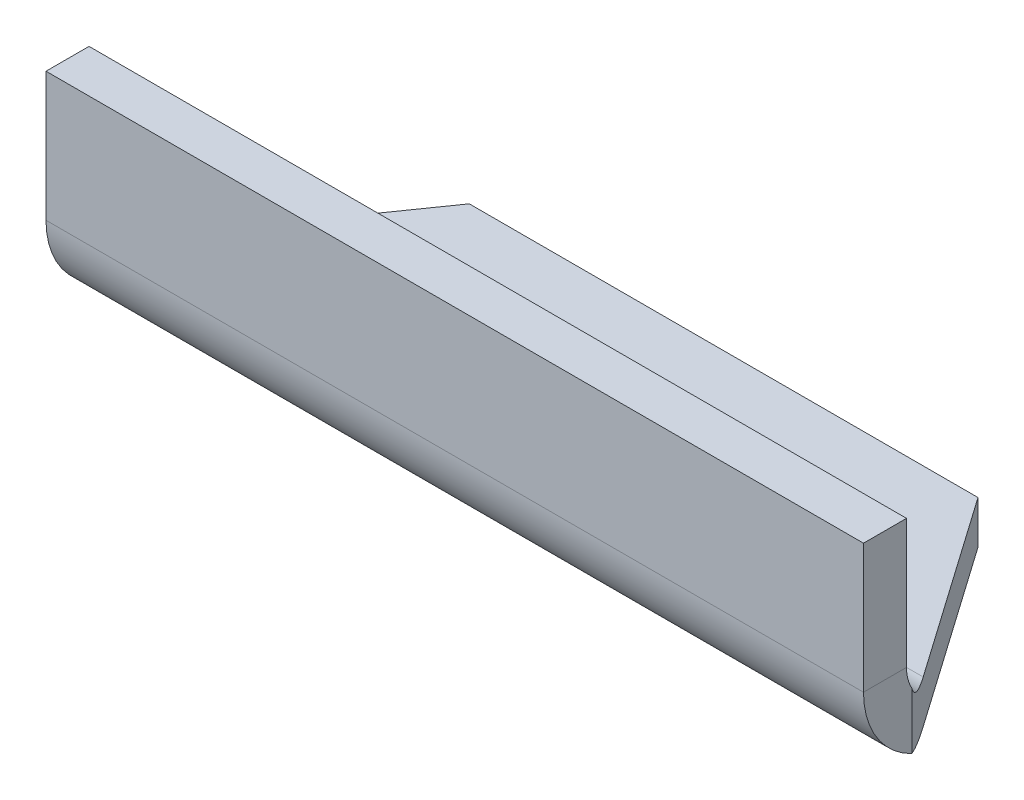
from build123d import *

# Parameters (mm, degrees)
SKETCH1_W                    = 152
SKETCH1_H                    = 50
BASE_FLANGE1_DEPTH           = 8
EDGE_FLANGE1_STRIP_W         = 48
EDGE_FLANGE1_STRIP_H         = 8
EDGE_FLANGE1_STRIP_CUT_DEPTH = 152
EDGE_FLANGE1_DEPTH           = 152
CHAMFER1_SIZE                = 41
CHAMFER1_SIZE2               = 28.708509067
MIRROR3_START                = 53.078332384
MIRROR3_OUTLINE_W            = 53
MIRROR3_OUTLINE_H            = 14
MIRROR3_DEPTH                = 23.516633891


# Read off the part's stored shape, not the designer's step: Mirror3
# Sheet-metal steps are written as plain solids
with BuildPart() as part:
    # Sketch1 → Base-Flange1 (new body)
    with BuildSketch(Plane(origin=(0, 0, 0), x_dir=(1, 0, 0), z_dir=(0, 1, 0))):
        Rectangle(SKETCH1_W, SKETCH1_H)
    extrude(amount=-BASE_FLANGE1_DEPTH)

    # Edge-Flange1 strip (across the edge) → Edge-Flange1 strip cut (cut)
    with BuildSketch(Plane(origin=(-76, 0, 25), x_dir=(0, 0, -1), z_dir=(1, 0, 0))):
        with Locations((-8, -4)):
            Rectangle(EDGE_FLANGE1_STRIP_W, EDGE_FLANGE1_STRIP_H)
    extrude(amount=EDGE_FLANGE1_STRIP_CUT_DEPTH, mode=Mode.SUBTRACT)

    # Edge-Flange1 section (across the edge) → Edge-Flange1 (add)
    with BuildSketch(Plane(origin=(-76, 0, 25), x_dir=(0, 0, -1), z_dir=(1, 0, 0))):
        with BuildLine():
            Line((0, 8), (0, 32))
            Line((0, 32), (8, 32))
            Line((8, 32), (8, 8))
            ThreePointArc((8, 8), (10.343145751, 2.343145751), (16, 0))
            Line((16, 0), (16, -8))
            ThreePointArc((16, -8), (4.686291501, -3.313708499), (0, 8))
        make_face()
    extrude(amount=EDGE_FLANGE1_DEPTH)

    # Chamfer1
    chamfer1_edges = [part.edges().sort_by_distance(p)[0] for p in [
        (-76, -4, -25),
    ]]
    chamfer1_side = [part.faces().sort_by_distance(p)[0] for p in [
        (-76, -0.640312424, -8),
    ]]
    chamfer(chamfer1_edges, length=CHAMFER1_SIZE, length2=CHAMFER1_SIZE2, reference=chamfer1_side[0])

    # Mirror3 outline → Mirror3 (cut)
    with BuildSketch(Plane(origin=(0, 0, 0), x_dir=(0.5735764363510512, 0, 0.8191520442889882), z_dir=(0.8191520442889882, 0, -0.5735764363510512)).offset(MIRROR3_START)):
        with Locations((31.5, 1)):
            Rectangle(MIRROR3_OUTLINE_W, MIRROR3_OUTLINE_H)
    extrude(amount=MIRROR3_DEPTH, mode=Mode.SUBTRACT)


solid = part.part
